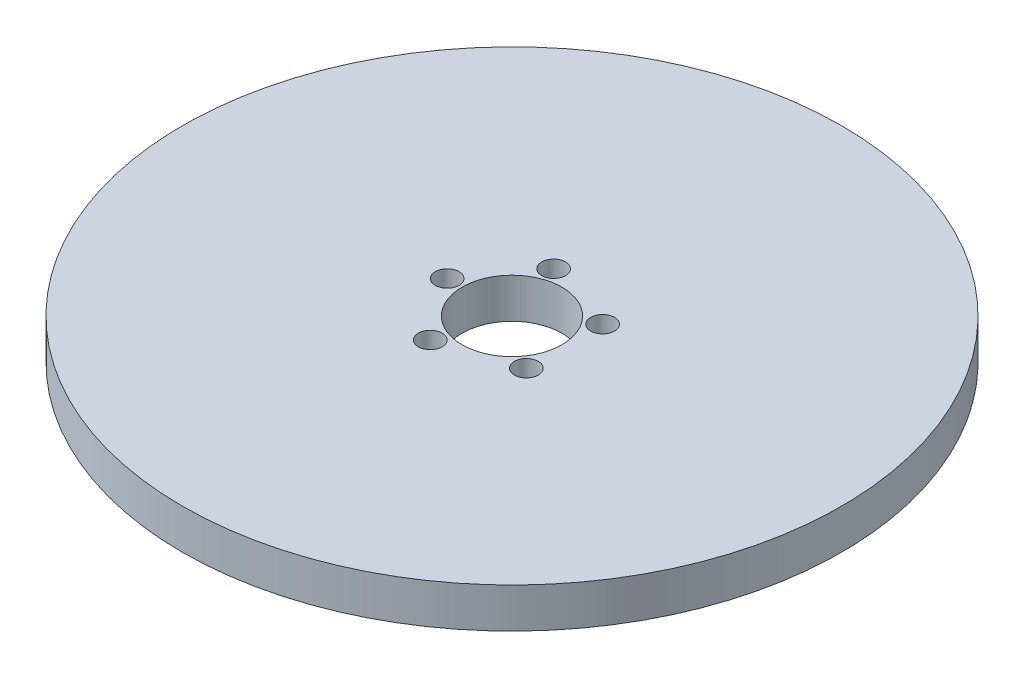
from build123d import *

# Parameters (mm, degrees)
SKETCH1_R           = 82.5
BOSS_EXTRUDE1_DEPTH = 10
SKETCH2_R           = 12.5
CUT_EXTRUDE1_DEPTH  = 118.100384286
SKETCH3_R           = 2.981424368
CUT_EXTRUDE2_DEPTH  = 9.050179742
CIRPATTERN1_COUNT   = 5


with BuildPart() as part:
    # Sketch1 → Boss-Extrude1 (new body)
    with BuildSketch(Plane(origin=(0, 0, 0), x_dir=(1, 0, 0), z_dir=(0, 1, 0))):
        Circle(SKETCH1_R)
    extrude(amount=BOSS_EXTRUDE1_DEPTH)

    # Sketch2 → Cut-Extrude1 (cut, through all)
    with BuildSketch(Plane(origin=(0, 0, 0), x_dir=(1, 0, 0), z_dir=(0, 1, 0))):
        Circle(SKETCH2_R)
    extrude(amount=CUT_EXTRUDE1_DEPTH, mode=Mode.SUBTRACT)

    # Sketch3 → Cut-Extrude2 (cut)
    with BuildSketch(Plane(origin=(0, 10, 0), x_dir=(1, 0, 0), z_dir=(0, 1, 0))):
        with Locations((-16.233113514, 0)):
            Circle(SKETCH3_R)
    cut_extrude2 = extrude(amount=-CUT_EXTRUDE2_DEPTH, mode=Mode.SUBTRACT)

    # CirPattern1: Cut-Extrude2 ×5 about axis
    cirpattern1_axis = Axis((0, 0, 0), (0, 1, 0))
    for i in range(1, CIRPATTERN1_COUNT):
        add(cut_extrude2.rotate(cirpattern1_axis, i * 360 / CIRPATTERN1_COUNT), mode=Mode.SUBTRACT)


solid = part.part
